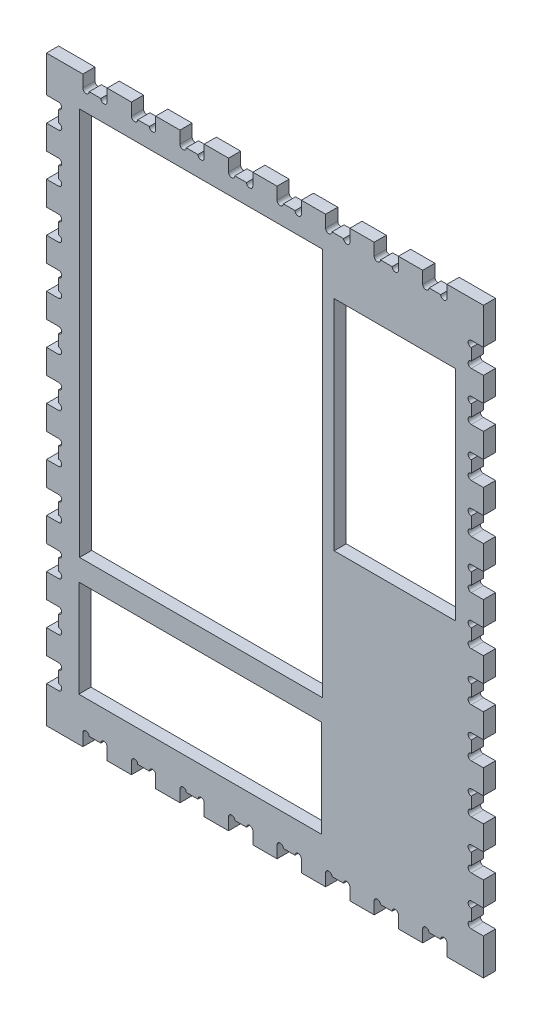
from build123d import *

# Parameters (mm, degrees)
SKETCH1_W             = 457.2
SKETCH1_H             = 609.6
BOSS_EXTRUDE1_DEPTH   = 12.7
CUT_EXTRUDE1_DEPTH    = 382.211607903
LPATTERN1_COUNT       = 8
LPATTERN1_PITCH       = 50.8
CUT_EXTRUDE2_DEPTH    = 382.211607903
LPATTERN2_COUNT       = 11
LPATTERN2_PITCH       = 50.8
MIRROR1_COPY_1_DEPTH  = 382.211607903
MIRROR1_COPY_2_DEPTH  = 382.211607903
MIRROR1_COPY_3_DEPTH  = 382.211607903
MIRROR1_COPY_4_DEPTH  = 382.211607903
MIRROR1_COPY_5_DEPTH  = 382.211607903
MIRROR1_COPY_6_DEPTH  = 382.211607903
MIRROR1_COPY_7_DEPTH  = 382.211607903
MIRROR1_COPY_8_DEPTH  = 382.211607903
MIRROR1_COPY_9_DEPTH  = 382.211607903
MIRROR1_COPY_10_DEPTH = 382.211607903
MIRROR1_COPY_11_DEPTH = 382.211607903
MIRROR2_COPY_1_DEPTH  = 382.211607903
MIRROR2_COPY_2_DEPTH  = 382.211607903
MIRROR2_COPY_3_DEPTH  = 382.211607903
MIRROR2_COPY_4_DEPTH  = 382.211607903
MIRROR2_COPY_5_DEPTH  = 382.211607903
MIRROR2_COPY_6_DEPTH  = 382.211607903
MIRROR2_COPY_7_DEPTH  = 382.211607903
MIRROR2_COPY_8_DEPTH  = 382.211607903
SKETCH4_W             = 254
SKETCH4_H             = 406.4
SKETCH4_W_2           = 127
SKETCH4_H_2           = 228.6
SKETCH4_H_3           = 101.6
CUT_EXTRUDE3_DEPTH    = 382.211607903


with BuildPart() as part:
    # Sketch1 → Boss-Extrude1 (new body)
    with BuildSketch(Plane.XY):
        Rectangle(SKETCH1_W, SKETCH1_H)
    extrude(amount=BOSS_EXTRUDE1_DEPTH)

    # Sketch2 → Cut-Extrude1 (cut, through all)
    with BuildSketch(Plane.XY.offset(12.7)):
        with BuildLine():
            Line((-165.1, 304.8), (-190.5, 304.8))
            Line((-190.5, 304.8), (-190.5, 292.1))
            ThreePointArc((-190.5, 292.1), (-187.198, 288.798), (-183.896, 292.1))
            Line((-183.896, 292.1), (-171.704, 292.1))
            ThreePointArc((-171.704, 292.1), (-168.402, 288.798), (-165.1, 292.1))
            Line((-165.1, 292.1), (-165.1, 304.8))
        make_face()
    cut_extrude1 = extrude(amount=-CUT_EXTRUDE1_DEPTH, mode=Mode.SUBTRACT)

    # LPattern1: Cut-Extrude1 ×8
    with Locations(*[(i * LPATTERN1_PITCH, 0, 0) for i in range(1, LPATTERN1_COUNT)]):
        add(cut_extrude1, mode=Mode.SUBTRACT)

    # Sketch3 → Cut-Extrude2 (cut, through all)
    with BuildSketch(Plane.XY.offset(12.7)):
        with BuildLine():
            Line((-215.9, 266.7), (-228.6, 266.7))
            Line((-228.6, 266.7), (-228.6, 241.3))
            Line((-228.6, 241.3), (-215.9, 241.3))
            ThreePointArc((-215.9, 241.3), (-212.598, 244.602), (-215.9, 247.904))
            Line((-215.9, 247.904), (-215.9, 260.096))
            ThreePointArc((-215.9, 260.096), (-212.598, 263.398), (-215.9, 266.7))
        make_face()
    cut_extrude2 = extrude(amount=-CUT_EXTRUDE2_DEPTH, mode=Mode.SUBTRACT)

    # LPattern2: Cut-Extrude2 ×11
    with Locations(*[(0, -i * LPATTERN2_PITCH, 0) for i in range(1, LPATTERN2_COUNT)]):
        add(cut_extrude2, mode=Mode.SUBTRACT)

    # Mirror1 copy 1 sketch → Mirror1 copy 1 (cut, through all)
    with BuildSketch(Plane(origin=(0, -50.8, 12.7), x_dir=(-1, 0, 0), z_dir=(0, 0, 1))):
        with BuildLine():
            Line((-215.9, -266.7), (-228.6, -266.7))
            Line((-228.6, -266.7), (-228.6, -241.3))
            Line((-228.6, -241.3), (-215.9, -241.3))
            ThreePointArc((-215.9, -241.3), (-212.598, -244.602), (-215.9, -247.904))
            Line((-215.9, -247.904), (-215.9, -260.096))
            ThreePointArc((-215.9, -260.096), (-212.598, -263.398), (-215.9, -266.7))
        make_face()
    extrude(amount=-MIRROR1_COPY_1_DEPTH, mode=Mode.SUBTRACT)

    # Mirror1 copy 2 sketch → Mirror1 copy 2 (cut, through all)
    with BuildSketch(Plane(origin=(0, -101.6, 12.7), x_dir=(-1, 0, 0), z_dir=(0, 0, 1))):
        with BuildLine():
            Line((-215.9, -266.7), (-228.6, -266.7))
            Line((-228.6, -266.7), (-228.6, -241.3))
            Line((-228.6, -241.3), (-215.9, -241.3))
            ThreePointArc((-215.9, -241.3), (-212.598, -244.602), (-215.9, -247.904))
            Line((-215.9, -247.904), (-215.9, -260.096))
            ThreePointArc((-215.9, -260.096), (-212.598, -263.398), (-215.9, -266.7))
        make_face()
    extrude(amount=-MIRROR1_COPY_2_DEPTH, mode=Mode.SUBTRACT)

    # Mirror1 copy 3 sketch → Mirror1 copy 3 (cut, through all)
    with BuildSketch(Plane(origin=(0, -152.4, 12.7), x_dir=(-1, 0, 0), z_dir=(0, 0, 1))):
        with BuildLine():
            Line((-215.9, -266.7), (-228.6, -266.7))
            Line((-228.6, -266.7), (-228.6, -241.3))
            Line((-228.6, -241.3), (-215.9, -241.3))
            ThreePointArc((-215.9, -241.3), (-212.598, -244.602), (-215.9, -247.904))
            Line((-215.9, -247.904), (-215.9, -260.096))
            ThreePointArc((-215.9, -260.096), (-212.598, -263.398), (-215.9, -266.7))
        make_face()
    extrude(amount=-MIRROR1_COPY_3_DEPTH, mode=Mode.SUBTRACT)

    # Mirror1 copy 4 sketch → Mirror1 copy 4 (cut, through all)
    with BuildSketch(Plane(origin=(0, -203.2, 12.7), x_dir=(-1, 0, 0), z_dir=(0, 0, 1))):
        with BuildLine():
            Line((-215.9, -266.7), (-228.6, -266.7))
            Line((-228.6, -266.7), (-228.6, -241.3))
            Line((-228.6, -241.3), (-215.9, -241.3))
            ThreePointArc((-215.9, -241.3), (-212.598, -244.602), (-215.9, -247.904))
            Line((-215.9, -247.904), (-215.9, -260.096))
            ThreePointArc((-215.9, -260.096), (-212.598, -263.398), (-215.9, -266.7))
        make_face()
    extrude(amount=-MIRROR1_COPY_4_DEPTH, mode=Mode.SUBTRACT)

    # Mirror1 copy 5 sketch → Mirror1 copy 5 (cut, through all)
    with BuildSketch(Plane(origin=(0, -254, 12.7), x_dir=(-1, 0, 0), z_dir=(0, 0, 1))):
        with BuildLine():
            Line((-215.9, -266.7), (-228.6, -266.7))
            Line((-228.6, -266.7), (-228.6, -241.3))
            Line((-228.6, -241.3), (-215.9, -241.3))
            ThreePointArc((-215.9, -241.3), (-212.598, -244.602), (-215.9, -247.904))
            Line((-215.9, -247.904), (-215.9, -260.096))
            ThreePointArc((-215.9, -260.096), (-212.598, -263.398), (-215.9, -266.7))
        make_face()
    extrude(amount=-MIRROR1_COPY_5_DEPTH, mode=Mode.SUBTRACT)

    # Mirror1 copy 6 sketch → Mirror1 copy 6 (cut, through all)
    with BuildSketch(Plane(origin=(0, -304.8, 12.7), x_dir=(-1, 0, 0), z_dir=(0, 0, 1))):
        with BuildLine():
            Line((-215.9, -266.7), (-228.6, -266.7))
            Line((-228.6, -266.7), (-228.6, -241.3))
            Line((-228.6, -241.3), (-215.9, -241.3))
            ThreePointArc((-215.9, -241.3), (-212.598, -244.602), (-215.9, -247.904))
            Line((-215.9, -247.904), (-215.9, -260.096))
            ThreePointArc((-215.9, -260.096), (-212.598, -263.398), (-215.9, -266.7))
        make_face()
    extrude(amount=-MIRROR1_COPY_6_DEPTH, mode=Mode.SUBTRACT)

    # Mirror1 copy 7 sketch → Mirror1 copy 7 (cut, through all)
    with BuildSketch(Plane(origin=(0, -355.6, 12.7), x_dir=(-1, 0, 0), z_dir=(0, 0, 1))):
        with BuildLine():
            Line((-215.9, -266.7), (-228.6, -266.7))
            Line((-228.6, -266.7), (-228.6, -241.3))
            Line((-228.6, -241.3), (-215.9, -241.3))
            ThreePointArc((-215.9, -241.3), (-212.598, -244.602), (-215.9, -247.904))
            Line((-215.9, -247.904), (-215.9, -260.096))
            ThreePointArc((-215.9, -260.096), (-212.598, -263.398), (-215.9, -266.7))
        make_face()
    extrude(amount=-MIRROR1_COPY_7_DEPTH, mode=Mode.SUBTRACT)

    # Mirror1 copy 8 sketch → Mirror1 copy 8 (cut, through all)
    with BuildSketch(Plane(origin=(0, -406.4, 12.7), x_dir=(-1, 0, 0), z_dir=(0, 0, 1))):
        with BuildLine():
            Line((-215.9, -266.7), (-228.6, -266.7))
            Line((-228.6, -266.7), (-228.6, -241.3))
            Line((-228.6, -241.3), (-215.9, -241.3))
            ThreePointArc((-215.9, -241.3), (-212.598, -244.602), (-215.9, -247.904))
            Line((-215.9, -247.904), (-215.9, -260.096))
            ThreePointArc((-215.9, -260.096), (-212.598, -263.398), (-215.9, -266.7))
        make_face()
    extrude(amount=-MIRROR1_COPY_8_DEPTH, mode=Mode.SUBTRACT)

    # Mirror1 copy 9 sketch → Mirror1 copy 9 (cut, through all)
    with BuildSketch(Plane(origin=(0, -457.2, 12.7), x_dir=(-1, 0, 0), z_dir=(0, 0, 1))):
        with BuildLine():
            Line((-215.9, -266.7), (-228.6, -266.7))
            Line((-228.6, -266.7), (-228.6, -241.3))
            Line((-228.6, -241.3), (-215.9, -241.3))
            ThreePointArc((-215.9, -241.3), (-212.598, -244.602), (-215.9, -247.904))
            Line((-215.9, -247.904), (-215.9, -260.096))
            ThreePointArc((-215.9, -260.096), (-212.598, -263.398), (-215.9, -266.7))
        make_face()
    extrude(amount=-MIRROR1_COPY_9_DEPTH, mode=Mode.SUBTRACT)

    # Mirror1 copy 10 sketch → Mirror1 copy 10 (cut, through all)
    with BuildSketch(Plane(origin=(0, -508, 12.7), x_dir=(-1, 0, 0), z_dir=(0, 0, 1))):
        with BuildLine():
            Line((-215.9, -266.7), (-228.6, -266.7))
            Line((-228.6, -266.7), (-228.6, -241.3))
            Line((-228.6, -241.3), (-215.9, -241.3))
            ThreePointArc((-215.9, -241.3), (-212.598, -244.602), (-215.9, -247.904))
            Line((-215.9, -247.904), (-215.9, -260.096))
            ThreePointArc((-215.9, -260.096), (-212.598, -263.398), (-215.9, -266.7))
        make_face()
    extrude(amount=-MIRROR1_COPY_10_DEPTH, mode=Mode.SUBTRACT)

    # Mirror1 copy 11 sketch → Mirror1 copy 11 (cut, through all)
    with BuildSketch(Plane(origin=(0, 0, 12.7), x_dir=(-1, 0, 0), z_dir=(0, 0, 1))):
        with BuildLine():
            Line((-215.9, -266.7), (-228.6, -266.7))
            Line((-228.6, -266.7), (-228.6, -241.3))
            Line((-228.6, -241.3), (-215.9, -241.3))
            ThreePointArc((-215.9, -241.3), (-212.598, -244.602), (-215.9, -247.904))
            Line((-215.9, -247.904), (-215.9, -260.096))
            ThreePointArc((-215.9, -260.096), (-212.598, -263.398), (-215.9, -266.7))
        make_face()
    extrude(amount=-MIRROR1_COPY_11_DEPTH, mode=Mode.SUBTRACT)

    # Mirror2 copy 1 sketch → Mirror2 copy 1 (cut, through all)
    with BuildSketch(Plane(origin=(50.8, 0, 12.7), x_dir=(1, 0, 0), z_dir=(0, 0, 1))):
        with BuildLine():
            Line((-165.1, -304.8), (-190.5, -304.8))
            Line((-190.5, -304.8), (-190.5, -292.1))
            ThreePointArc((-190.5, -292.1), (-187.198, -288.798), (-183.896, -292.1))
            Line((-183.896, -292.1), (-171.704, -292.1))
            ThreePointArc((-171.704, -292.1), (-168.402, -288.798), (-165.1, -292.1))
            Line((-165.1, -292.1), (-165.1, -304.8))
        make_face()
    extrude(amount=-MIRROR2_COPY_1_DEPTH, mode=Mode.SUBTRACT)

    # Mirror2 copy 2 sketch → Mirror2 copy 2 (cut, through all)
    with BuildSketch(Plane(origin=(101.6, 0, 12.7), x_dir=(1, 0, 0), z_dir=(0, 0, 1))):
        with BuildLine():
            Line((-165.1, -304.8), (-190.5, -304.8))
            Line((-190.5, -304.8), (-190.5, -292.1))
            ThreePointArc((-190.5, -292.1), (-187.198, -288.798), (-183.896, -292.1))
            Line((-183.896, -292.1), (-171.704, -292.1))
            ThreePointArc((-171.704, -292.1), (-168.402, -288.798), (-165.1, -292.1))
            Line((-165.1, -292.1), (-165.1, -304.8))
        make_face()
    extrude(amount=-MIRROR2_COPY_2_DEPTH, mode=Mode.SUBTRACT)

    # Mirror2 copy 3 sketch → Mirror2 copy 3 (cut, through all)
    with BuildSketch(Plane(origin=(152.4, 0, 12.7), x_dir=(1, 0, 0), z_dir=(0, 0, 1))):
        with BuildLine():
            Line((-165.1, -304.8), (-190.5, -304.8))
            Line((-190.5, -304.8), (-190.5, -292.1))
            ThreePointArc((-190.5, -292.1), (-187.198, -288.798), (-183.896, -292.1))
            Line((-183.896, -292.1), (-171.704, -292.1))
            ThreePointArc((-171.704, -292.1), (-168.402, -288.798), (-165.1, -292.1))
            Line((-165.1, -292.1), (-165.1, -304.8))
        make_face()
    extrude(amount=-MIRROR2_COPY_3_DEPTH, mode=Mode.SUBTRACT)

    # Mirror2 copy 4 sketch → Mirror2 copy 4 (cut, through all)
    with BuildSketch(Plane(origin=(203.2, 0, 12.7), x_dir=(1, 0, 0), z_dir=(0, 0, 1))):
        with BuildLine():
            Line((-165.1, -304.8), (-190.5, -304.8))
            Line((-190.5, -304.8), (-190.5, -292.1))
            ThreePointArc((-190.5, -292.1), (-187.198, -288.798), (-183.896, -292.1))
            Line((-183.896, -292.1), (-171.704, -292.1))
            ThreePointArc((-171.704, -292.1), (-168.402, -288.798), (-165.1, -292.1))
            Line((-165.1, -292.1), (-165.1, -304.8))
        make_face()
    extrude(amount=-MIRROR2_COPY_4_DEPTH, mode=Mode.SUBTRACT)

    # Mirror2 copy 5 sketch → Mirror2 copy 5 (cut, through all)
    with BuildSketch(Plane(origin=(254, 0, 12.7), x_dir=(1, 0, 0), z_dir=(0, 0, 1))):
        with BuildLine():
            Line((-165.1, -304.8), (-190.5, -304.8))
            Line((-190.5, -304.8), (-190.5, -292.1))
            ThreePointArc((-190.5, -292.1), (-187.198, -288.798), (-183.896, -292.1))
            Line((-183.896, -292.1), (-171.704, -292.1))
            ThreePointArc((-171.704, -292.1), (-168.402, -288.798), (-165.1, -292.1))
            Line((-165.1, -292.1), (-165.1, -304.8))
        make_face()
    extrude(amount=-MIRROR2_COPY_5_DEPTH, mode=Mode.SUBTRACT)

    # Mirror2 copy 6 sketch → Mirror2 copy 6 (cut, through all)
    with BuildSketch(Plane(origin=(304.8, 0, 12.7), x_dir=(1, 0, 0), z_dir=(0, 0, 1))):
        with BuildLine():
            Line((-165.1, -304.8), (-190.5, -304.8))
            Line((-190.5, -304.8), (-190.5, -292.1))
            ThreePointArc((-190.5, -292.1), (-187.198, -288.798), (-183.896, -292.1))
            Line((-183.896, -292.1), (-171.704, -292.1))
            ThreePointArc((-171.704, -292.1), (-168.402, -288.798), (-165.1, -292.1))
            Line((-165.1, -292.1), (-165.1, -304.8))
        make_face()
    extrude(amount=-MIRROR2_COPY_6_DEPTH, mode=Mode.SUBTRACT)

    # Mirror2 copy 7 sketch → Mirror2 copy 7 (cut, through all)
    with BuildSketch(Plane(origin=(355.6, 0, 12.7), x_dir=(1, 0, 0), z_dir=(0, 0, 1))):
        with BuildLine():
            Line((-165.1, -304.8), (-190.5, -304.8))
            Line((-190.5, -304.8), (-190.5, -292.1))
            ThreePointArc((-190.5, -292.1), (-187.198, -288.798), (-183.896, -292.1))
            Line((-183.896, -292.1), (-171.704, -292.1))
            ThreePointArc((-171.704, -292.1), (-168.402, -288.798), (-165.1, -292.1))
            Line((-165.1, -292.1), (-165.1, -304.8))
        make_face()
    extrude(amount=-MIRROR2_COPY_7_DEPTH, mode=Mode.SUBTRACT)

    # Mirror2 copy 8 sketch → Mirror2 copy 8 (cut, through all)
    with BuildSketch(Plane.XY.offset(12.7)):
        with BuildLine():
            Line((-165.1, -304.8), (-190.5, -304.8))
            Line((-190.5, -304.8), (-190.5, -292.1))
            ThreePointArc((-190.5, -292.1), (-187.198, -288.798), (-183.896, -292.1))
            Line((-183.896, -292.1), (-171.704, -292.1))
            ThreePointArc((-171.704, -292.1), (-168.402, -288.798), (-165.1, -292.1))
            Line((-165.1, -292.1), (-165.1, -304.8))
        make_face()
    extrude(amount=-MIRROR2_COPY_8_DEPTH, mode=Mode.SUBTRACT)

    # Sketch4 → Cut-Extrude3 (cut, through all)
    with BuildSketch(Plane(origin=(0, 0, 0), x_dir=(-1, 0, 0), z_dir=(0, 0, -1))):
        with Locations((66.971819209, 68.230234576)):
            Rectangle(SKETCH4_W, SKETCH4_H)
        with Locations((-135.884559718, 118.499503968)):
            Rectangle(SKETCH4_W_2, SKETCH4_H_2)
        with Locations((67.792027568, -208.474894222)):
            Rectangle(SKETCH4_W, SKETCH4_H_3)
    extrude(amount=-CUT_EXTRUDE3_DEPTH, mode=Mode.SUBTRACT)


solid = part.part
